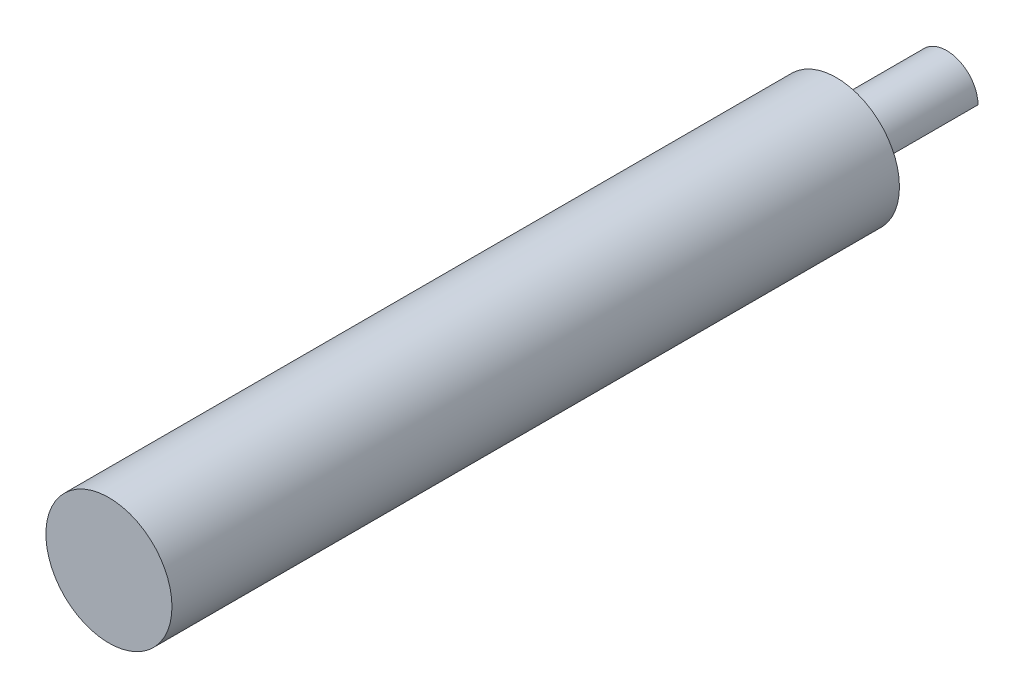
from build123d import *

# Parameters (mm, degrees)
SKETCH1_R               = 3.1623
BOSS_EXTRUDE1_DEPTH     = 11.0998
CUT_EXTRUDE1_DEPTH      = 12.96686436
CUT_EXTRUDE1_DEPTH_BACK = 12.96686436
SKETCH3_R               = 6.35
BOSS_EXTRUDE2_DEPTH     = 73.279
FILLET1_R               = 1.27


with BuildPart() as part:
    # Sketch1 → Boss-Extrude1 (new body)
    with BuildSketch(Plane.XY):
        Circle(SKETCH1_R)
    extrude(amount=BOSS_EXTRUDE1_DEPTH)

    # Sketch2 → Cut-Extrude1 (cut, two sides: drawn at the far end of the back side and taken through both)
    with BuildSketch(Plane(origin=(0, 0, 0), x_dir=(-1, 0, 0), z_dir=(0, 0, -1)).offset(-CUT_EXTRUDE1_DEPTH_BACK)):
        Polygon((17.073178183, -20.234228338), (0.001249598, -3.162299753), (-3.162299753, 0.001249598), (-20.234228338, 17.073178183), (-54.378085507, -17.070678986), (-17.070678986, -54.378085507), align=None)
    extrude(amount=CUT_EXTRUDE1_DEPTH + CUT_EXTRUDE1_DEPTH_BACK, mode=Mode.SUBTRACT)

    # Sketch3 → Boss-Extrude2 (add)
    with BuildSketch(Plane.XY.offset(11.0998)):
        Circle(SKETCH3_R)
    extrude(amount=BOSS_EXTRUDE2_DEPTH)

    # Fillet1
    fillet1_edges = [part.edges().sort_by_distance(p)[0] for p in [
        (-2.236083774, 2.236083774, 11.0998),
        (1.580525077, -1.580525077, 11.0998),
    ]]
    fillet(fillet1_edges, radius=FILLET1_R)


solid = part.part
